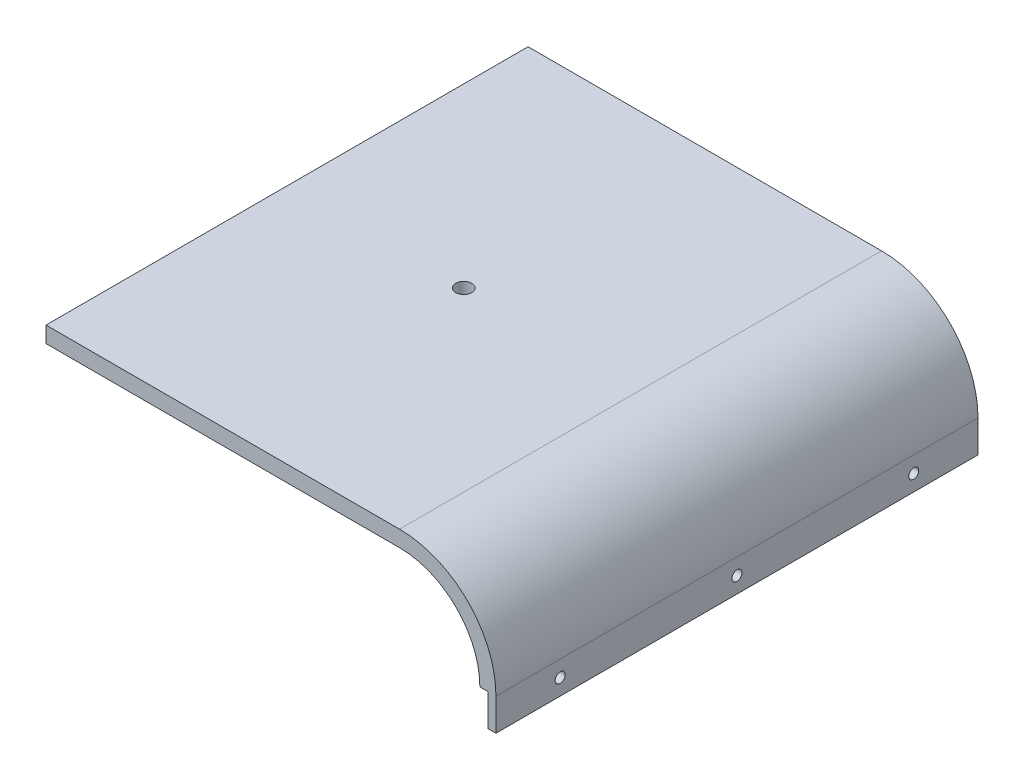
from build123d import *

# Parameters (mm, degrees)
BOSS_EXTRUDE1_DEPTH      = 190.5
BOSS_EXTRUDE1_DEPTH_BACK = 190.5
SKETCH2_W                = 6.35
SKETCH2_H                = 381
BOSS_EXTRUDE2_DEPTH      = 25.4
SKETCH3_R                = 3.96875
CUT_EXTRUDE1_DEPTH       = 25.4
SKETCH4_R                = 6.35
CUT_EXTRUDE2_DEPTH       = 17.78


with BuildPart() as part:
    # Sketch1 → Boss-Extrude1 (new, two sides: drawn at the far end of the back side and taken through both)
    with BuildSketch(Plane.XY.offset(-BOSS_EXTRUDE1_DEPTH_BACK)):
        with BuildLine():
            Line((-139.7, 0), (139.7, 0))
            ThreePointArc((139.7, 0), (193.581536726, -22.318463274), (215.9, -76.2))
            Line((215.9, -76.2), (203.2, -76.2))
            ThreePointArc((203.2, -76.2), (184.601280605, -31.298719395), (139.7, -12.7))
            Line((139.7, -12.7), (-139.7, -12.7))
            Line((-139.7, -12.7), (-139.7, 0))
        make_face()
    extrude(amount=BOSS_EXTRUDE1_DEPTH + BOSS_EXTRUDE1_DEPTH_BACK)

    # Sketch2 → Boss-Extrude2 (add)
    with BuildSketch(Plane.XZ.offset(76.2)):
        with Locations((212.725, 0)):
            Rectangle(SKETCH2_W, SKETCH2_H)
    extrude(amount=BOSS_EXTRUDE2_DEPTH)

    # Sketch3 → Cut-Extrude1 (cut)
    with BuildSketch(Plane(origin=(215.9, 0, 0), x_dir=(0, 0, -1), z_dir=(1, 0, 0))):
        with Locations((-139.7, -88.9)):
            Circle(SKETCH3_R)
        with Locations((0, -88.9)):
            Circle(SKETCH3_R)
        with Locations((139.7, -88.9)):
            Circle(SKETCH3_R)
    extrude(amount=-CUT_EXTRUDE1_DEPTH, mode=Mode.SUBTRACT)

    # Sketch4 → Cut-Extrude2 (cut)
    with BuildSketch(Plane(origin=(0, 0, 0), x_dir=(1, 0, 0), z_dir=(0, 1, 0))):
        Circle(SKETCH4_R)
    extrude(amount=-CUT_EXTRUDE2_DEPTH, mode=Mode.SUBTRACT)


solid = part.part
